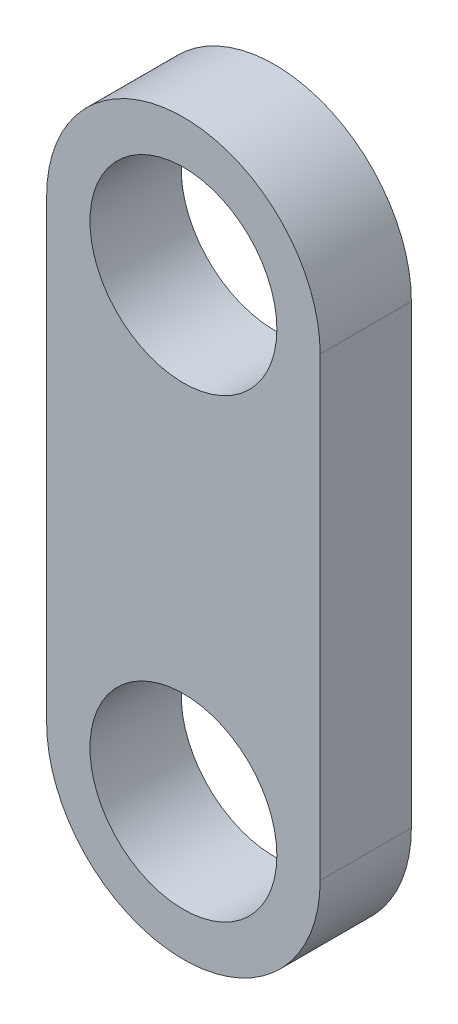
from build123d import *

# Parameters (mm, degrees)
SKETCH1_R           = 10.25
BOSS_EXTRUDE1_DEPTH = 10


with BuildPart() as part:
    # Sketch1 → Boss-Extrude1 (new body)
    with BuildSketch(Plane.XY):
        with BuildLine():
            Line((15, -50), (15, 0))
            ThreePointArc((15, 0), (0, 15), (-15, 0))
            Line((-15, 0), (-15, -50))
            ThreePointArc((-15, -50), (0, -65), (15, -50))
        make_face()
        with Locations((0, -50)):
            Circle(SKETCH1_R, mode=Mode.SUBTRACT)
        Circle(SKETCH1_R, mode=Mode.SUBTRACT)
    extrude(amount=BOSS_EXTRUDE1_DEPTH)


solid = part.part
